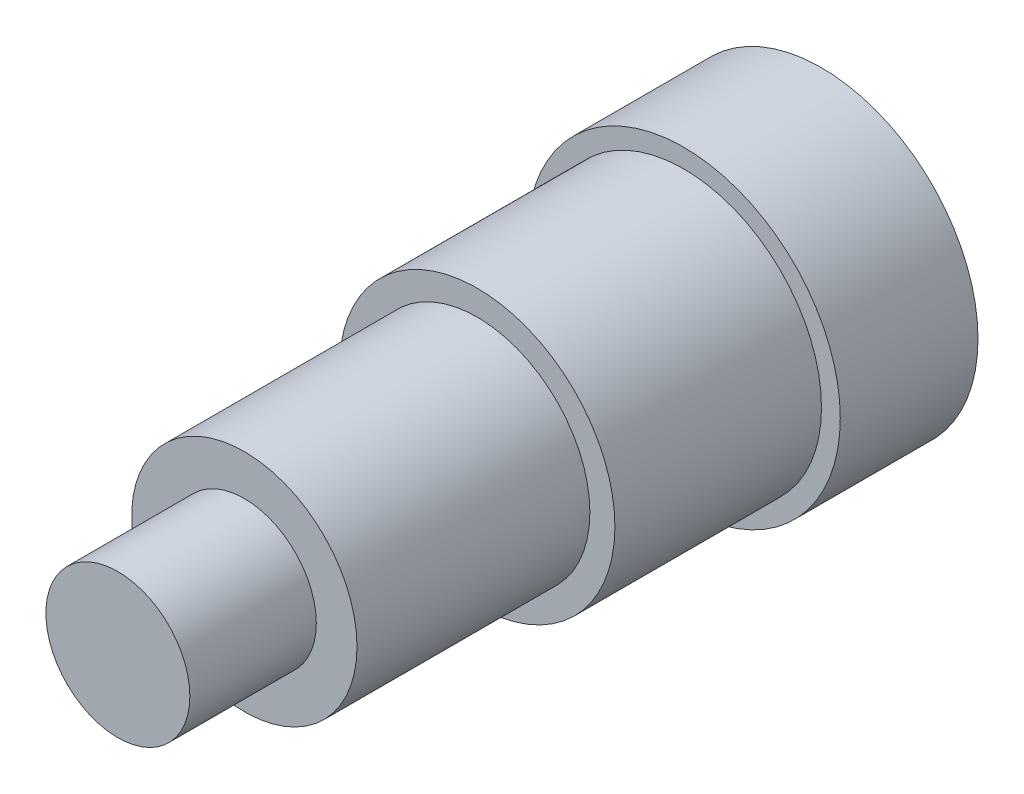
from build123d import *

# Parameters (mm, degrees)
SKETCH1_R           = 12.5
BOSS_EXTRUDE1_DEPTH = 11
SKETCH2_R           = 11
BOSS_EXTRUDE2_DEPTH = 16.5
SKETCH3_R           = 9
BOSS_EXTRUDE3_DEPTH = 18.6
SKETCH4_R           = 5.75
BOSS_EXTRUDE4_DEPTH = 10.1
SKETCH5_R           = 11.75
CUT_EXTRUDE1_DEPTH  = 4.5
BOSS_EXTRUDE5_START = 2
SKETCH6_R           = 11.75
BOSS_EXTRUDE5_DEPTH = 2


# Read off the part's stored shape, not the designer's step: Dome1
with BuildPart() as part:
    # Sketch1 → Boss-Extrude1 (new body)
    with BuildSketch(Plane.XY):
        Circle(SKETCH1_R)
    extrude(amount=BOSS_EXTRUDE1_DEPTH)

    # Sketch2 → Boss-Extrude2 (add)
    with BuildSketch(Plane.XY.offset(11)):
        Circle(SKETCH2_R)
    extrude(amount=BOSS_EXTRUDE2_DEPTH)

    # Sketch3 → Boss-Extrude3 (add)
    with BuildSketch(Plane.XY.offset(27.5)):
        Circle(SKETCH3_R)
    extrude(amount=BOSS_EXTRUDE3_DEPTH)

    # Sketch4 → Boss-Extrude4 (add)
    with BuildSketch(Plane.XY.offset(46.1)):
        Circle(SKETCH4_R)
    extrude(amount=BOSS_EXTRUDE4_DEPTH)

    # Sketch5 → Cut-Extrude1 (cut)
    with BuildSketch(Plane(origin=(0, 0, 0), x_dir=(-1, 0, 0), z_dir=(0, 0, -1))):
        Circle(SKETCH5_R)
    extrude(amount=-CUT_EXTRUDE1_DEPTH, mode=Mode.SUBTRACT)

    # Sketch6 → Boss-Extrude5 (add)
    with BuildSketch(Plane(origin=(0, 0, 4.5), x_dir=(-1, 0, 0), z_dir=(0, 0, -1)).offset(BOSS_EXTRUDE5_START)):
        Circle(SKETCH6_R)
    extrude(amount=-BOSS_EXTRUDE5_DEPTH)

    # Dome1 outline → Dome1 (revolve)
    with BuildSketch(Plane.XZ):
        with BuildLine():
            Line((0, 2.500000012), (0, -3))
            ThreePointArc((0, -3), (6.48676538, -1.556953293), (11.75000001, 2.500000012))
            Line((11.75000001, 2.500000012), (0, 2.500000012))
        make_face()
    revolve(axis=Axis((0, 0, 0), (0, 0, 1)))


solid = part.part
